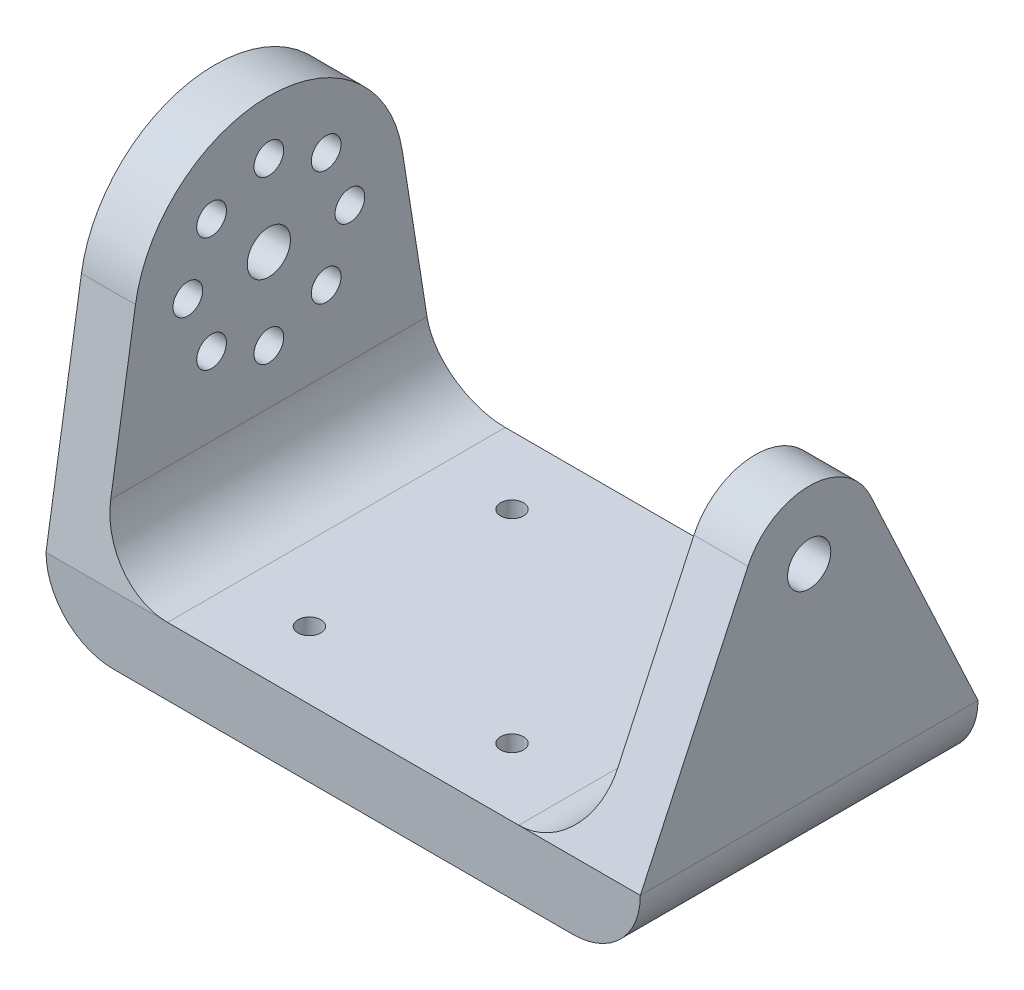
from build123d import *

# Parameters (mm, degrees)
SKETCH_1_W          = 44
SKETCH_1_H          = 25
EXTRUDE_1_DEPTH     = 5
SKETCH_2_R          = 1.1
SKETCH_2_R_2        = 1.6
EXTRUDE_2_DEPTH     = 4
EXTRUDE_START       = -4
SKETCH_3_R          = 1.6
EXTRUDE_3_DEPTH     = 4
FILLET_1_R          = 5
SKETCH_4_R          = 0.85
CUT_EXTRUDE_1_DEPTH = 5


with BuildPart() as part:
    # ｽｹｯﾁ1 → ﾎﾞｽ - 押し出し1 (new body)
    with BuildSketch(Plane(origin=(0, 0, 0), x_dir=(1, 0, 0), z_dir=(0, 1, 0))):
        with Locations((0, 12.5)):
            Rectangle(SKETCH_1_W, SKETCH_1_H)
    extrude(amount=EXTRUDE_1_DEPTH)

    # ｽｹｯﾁ2 → ﾎﾞｽ - 押し出し2 (add)
    with BuildSketch(Plane.ZY.offset(22)):
        with BuildLine():
            Line((-25, 5), (0, 5))
            Line((0, 5), (-2.623078099, 21.564101584))
            ThreePointArc((-2.623078099, 21.564101584), (-12.5, 30), (-22.376921901, 21.564101584))
            Line((-22.376921901, 21.564101584), (-25, 5))
        make_face()
        with Locations((-12.5, 26)):
            Circle(SKETCH_2_R, mode=Mode.SUBTRACT)
        with Locations((-8.257359313, 24.242640687)):
            Circle(SKETCH_2_R, mode=Mode.SUBTRACT)
        with Locations((-6.5, 20)):
            Circle(SKETCH_2_R, mode=Mode.SUBTRACT)
        with Locations((-8.257359313, 15.757359313)):
            Circle(SKETCH_2_R, mode=Mode.SUBTRACT)
        with Locations((-12.5, 14)):
            Circle(SKETCH_2_R, mode=Mode.SUBTRACT)
        with Locations((-16.742640687, 15.757359313)):
            Circle(SKETCH_2_R, mode=Mode.SUBTRACT)
        with Locations((-18.5, 20)):
            Circle(SKETCH_2_R, mode=Mode.SUBTRACT)
        with Locations((-16.742640687, 24.242640687)):
            Circle(SKETCH_2_R, mode=Mode.SUBTRACT)
        with Locations((-12.5, 20)):
            Circle(SKETCH_2_R_2, mode=Mode.SUBTRACT)
    extrude(amount=-EXTRUDE_2_DEPTH)

    # ｽｹｯﾁ3 → ﾎﾞｽ - 押し出し3 (add)
    with BuildSketch(Plane(origin=(22, 0, 0), x_dir=(0, 0, -1), z_dir=(1, 0, 0)).offset(EXTRUDE_START)):
        with BuildLine():
            Line((0, 5), (7.96729454, 22.110587883))
            ThreePointArc((7.96729454, 22.110587883), (12.5, 25), (17.03270546, 22.110587883))
            Line((17.03270546, 22.110587883), (25, 5))
            Line((25, 5), (0, 5))
        make_face()
        with Locations((12.5, 20)):
            Circle(SKETCH_3_R, mode=Mode.SUBTRACT)
    extrude(amount=EXTRUDE_3_DEPTH)

    # ﾌｨﾚｯﾄ1
    fillet_1_edges = [part.edges().sort_by_distance(p)[0] for p in [
        (18, 5, -12.5),
        (-18, 5, -12.5),
        (22, 0, -12.5),
        (-22, 0, -12.5),
    ]]
    fillet(fillet_1_edges, radius=FILLET_1_R)

    # ｽｹｯﾁ4 → ｶｯﾄ - 押し出し1 (cut)
    with BuildSketch(Plane(origin=(0, 5, 0), x_dir=(1, 0, 0), z_dir=(0, 1, 0))):
        with Locations((-7.5, 20)):
            Circle(SKETCH_4_R)
        with Locations((7.5, 20)):
            Circle(SKETCH_4_R)
        with Locations((7.5, 5)):
            Circle(SKETCH_4_R)
        with Locations((-7.5, 5)):
            Circle(SKETCH_4_R)
    extrude(amount=-CUT_EXTRUDE_1_DEPTH, mode=Mode.SUBTRACT)


solid = part.part
